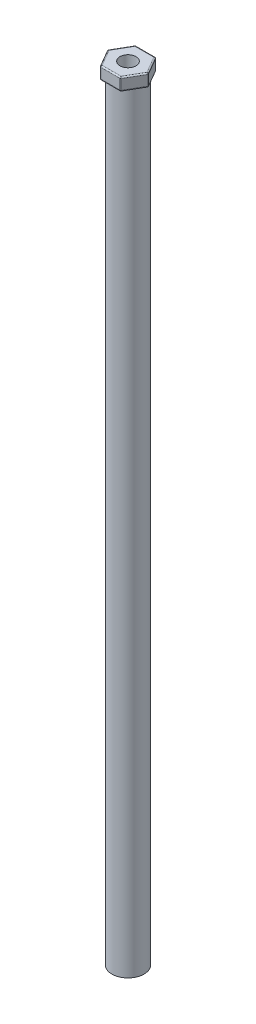
from build123d import *

# Parameters (mm, degrees)
SKETCH1_R           = 6.35
SKETCH1_R_2         = 3.175
BOSS_EXTRUDE1_DEPTH = 304.8
SKETCH2_R           = 3.175
BOSS_EXTRUDE2_DEPTH = 5
FILLET1_R           = 0.5


with BuildPart() as part:
    # Sketch1 → Boss-Extrude1 (new body)
    with BuildSketch(Plane(origin=(0, 0, 0), x_dir=(1, 0, 0), z_dir=(0, 1, 0))):
        Circle(SKETCH1_R)
        Circle(SKETCH1_R_2, mode=Mode.SUBTRACT)
    extrude(amount=BOSS_EXTRUDE1_DEPTH)

    # Sketch2 → Boss-Extrude2 (add)
    with BuildSketch(Plane(origin=(0, 304.8, 0), x_dir=(1, 0, 0), z_dir=(0, 1, 0))):
        Polygon((-8.065583261, 0), (-4.03279163, -6.985), (4.03279163, -6.985), (8.065583261, 0), (4.03279163, 6.985), (-4.03279163, 6.985), align=None)
        Circle(SKETCH2_R, mode=Mode.SUBTRACT)
    extrude(amount=BOSS_EXTRUDE2_DEPTH)

    # Fillet1
    fillet1_edges = [part.edges().sort_by_distance(p)[0] for p in [
        (6.049187445, 304.8, -3.4925),
        (4.03279163, 307.3, -6.985),
        (8.065583261, 307.3, 0),
        (-4.03279163, 307.3, -6.985),
        (-6.049187445, 304.8, -3.4925),
        (-8.065583261, 307.3, 0),
        (-6.049187445, 304.8, 3.4925),
        (-4.03279163, 307.3, 6.985),
        (0, 304.8, 6.985),
        (6.049187445, 304.8, 3.4925),
        (4.03279163, 307.3, 6.985),
        (6.049187445, 309.8, 3.4925),
        (6.049187445, 309.8, -3.4925),
        (0, 309.8, -6.985),
        (-6.049187445, 309.8, -3.4925),
        (-6.049187445, 309.8, 3.4925),
        (0, 309.8, 6.985),
        (0, 304.8, -6.985),
    ]]
    fillet(fillet1_edges, radius=FILLET1_R)


solid = part.part
